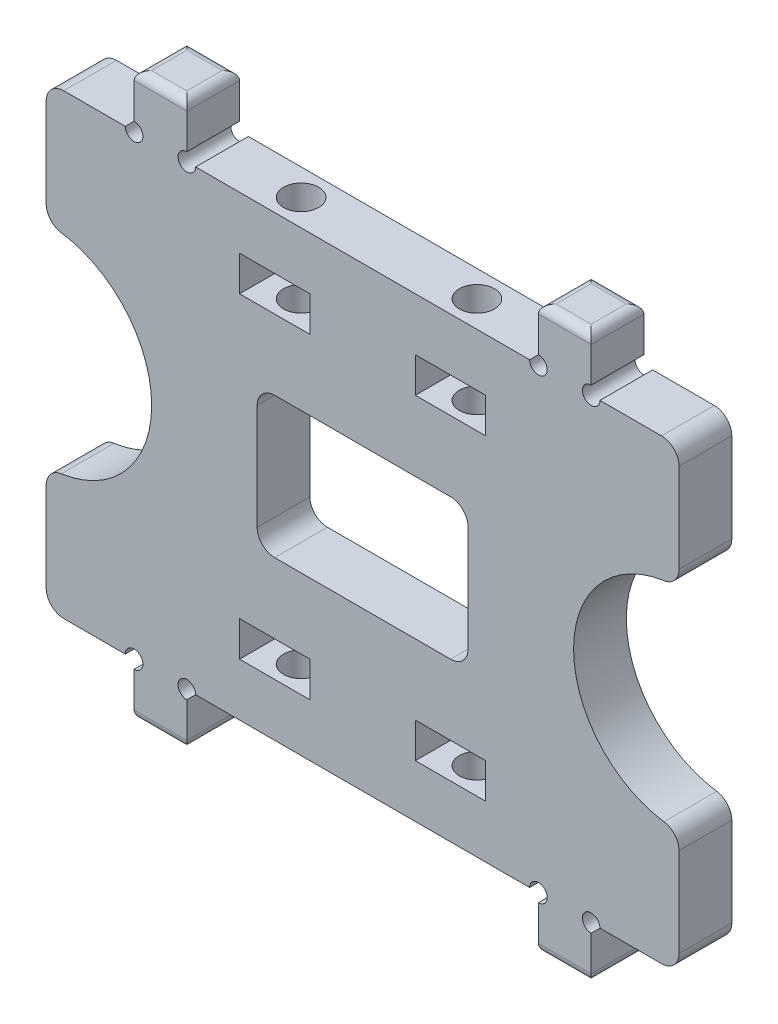
from build123d import *

# Parameters (mm, degrees)
SKETCH1_W           = 4
SKETCH1_H           = 2
BOSS_EXTRUDE1_DEPTH = 3
SKETCH2_R           = 1
CUT_EXTRUDE1_DEPTH  = 8
FILLET1_R           = 1
FILLET2_R           = 0.5
SKETCH3_W           = 12
SKETCH3_H           = 8
CUT_EXTRUDE2_DEPTH  = 10
FILLET3_R           = 1


with BuildPart() as part:
    # Sketch1 → Boss-Extrude1 (new body)
    with BuildSketch(Plane.XY):
        with BuildLine():
            Line((0, 9), (0, 0))
            Line((0, 0), (9.5, 0))
            ThreePointArc((9.5, 0), (10, 0.5), (10.5, 0))
            ThreePointArc((10.5, 0), (10.353553391, -0.353553391), (10, -0.5))
            Line((10, -0.5), (10, -3))
            Line((10, -3), (13, -3))
            Line((13, -3), (13, -0.5))
            ThreePointArc((13, -0.5), (12.646446609, 0.353553391), (13.5, 0))
            Line((13.5, 0), (18, 0))
            Line((18, 0), (18, 7))
            ThreePointArc((18, 7), (13.757359313, 8.757359313), (12, 13))
            Line((12, 13), (4.618802154, 13))
            Line((4.618802154, 13), (2.309401077, 9))
            Line((2.309401077, 9), (0, 9))
        make_face()
        with Locations((5, 4)):
            Rectangle(SKETCH1_W, SKETCH1_H, mode=Mode.SUBTRACT)
    extrude(amount=BOSS_EXTRUDE1_DEPTH)

    # Sketch2 → Cut-Extrude1 (cut)
    with BuildSketch(Plane.XZ):
        with Locations((5, 1.5)):
            Circle(SKETCH2_R)
    extrude(amount=-CUT_EXTRUDE1_DEPTH, mode=Mode.SUBTRACT)

    # Fillet1
    fillet1_edges = [part.edges().sort_by_distance(p)[0] for p in [
        (18, 7, 1.5),
        (18, 0, 1.5),
    ]]
    fillet(fillet1_edges, radius=FILLET1_R)

    # Fillet2
    fillet2_edges = [part.edges().sort_by_distance(p)[0] for p in [
        (10, -3, 1.5),
        (13, -3, 1.5),
        (11.5, -3, 0),
        (11.5, -3, 3),
    ]]
    fillet(fillet2_edges, radius=FILLET2_R)

    # Mirror1: part across plane


with BuildPart() as part_1:
    add(part.part)
    add(part.part.mirror(Plane(origin=(0, 0, 3), x_dir=(0, 0, 1), z_dir=(-1, 0, 0))))

    # Mirror2: part across plane


with BuildPart() as part_2:
    add(part_1.part)
    add(part_1.part.mirror(Plane(origin=(0, 13, 3), x_dir=(0, 0, 1), z_dir=(0, 1, 0))))

    # Sketch3 → Cut-Extrude2 (cut)
    with BuildSketch(Plane(origin=(0, 0, 0), x_dir=(-1, 0, 0), z_dir=(0, 0, -1))):
        with Locations((0, 13)):
            Rectangle(SKETCH3_W, SKETCH3_H)
    extrude(amount=-CUT_EXTRUDE2_DEPTH, mode=Mode.SUBTRACT)

    # Fillet3
    fillet3_edges = [part_2.edges().sort_by_distance(p)[0] for p in [
        (6, 9, 1.5),
        (-6, 9, 1.5),
        (-6, 17, 1.5),
        (6, 17, 1.5),
    ]]
    fillet(fillet3_edges, radius=FILLET3_R)


solid = part_2.part
